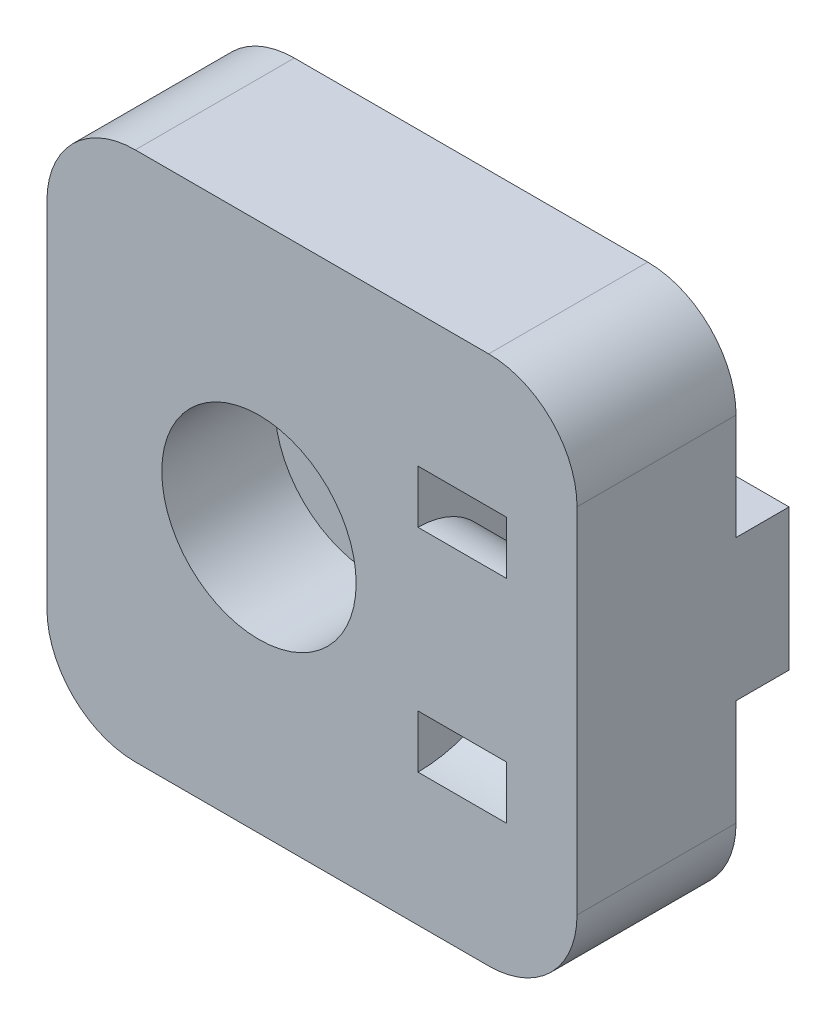
from build123d import *

# Parameters (mm, degrees)
SKICA1_W                                         = 30
SKICA1_H                                         = 30
P_IDAT_VYSUNUT_M1_DEPTH                          = 9
V_LCOV_ZAHLOUBEN_PRO_M6_ROUBY_S_VNIT_D           = 6.6
V_LCOV_ZAHLOUBEN_PRO_M6_ROUBY_S_VNIT_CBORE_D     = 11
V_LCOV_ZAHLOUBEN_PRO_M6_ROUBY_S_VNIT_CBORE_DEPTH = 6.4
TIE_SKETCH_R                                     = 7.5
TIE_SKETCH_R_2                                   = 4.5
ODEBRAT_VYSUNUT_M1_DEPTH                         = 5
P_IDAT_VYSUNUT_M2_DEPTH                          = 3
ZKOSEN_1_SIZE                                    = 3
ZAOBLIT1_R                                       = 5


with BuildPart() as part:
    # Skica1 → Přidat vysunutím1 (new body)
    with BuildSketch(Plane.XY):
        Rectangle(SKICA1_W, SKICA1_H)
    extrude(amount=P_IDAT_VYSUNUT_M1_DEPTH)

    # Válcové zahloubení pro M6 šrouby s vnitřním šestihranem1 (through all)
    with Locations(Plane.XY.offset(9)):
        with Locations((-3, 0), (-24.772543922, -8.516747489)):
            CounterBoreHole(V_LCOV_ZAHLOUBEN_PRO_M6_ROUBY_S_VNIT_D / 2, V_LCOV_ZAHLOUBEN_PRO_M6_ROUBY_S_VNIT_CBORE_D / 2, V_LCOV_ZAHLOUBEN_PRO_M6_ROUBY_S_VNIT_CBORE_DEPTH)

    # Tie sketch → Odebrat vysunutím1 (cut)
    with BuildSketch(Plane(origin=(11, 0, 0), x_dir=(0, 0, -1), z_dir=(1, 0, 0))):
        with Locations((-9, 0)):
            Circle(TIE_SKETCH_R)
        with Locations((-9, 0)):
            Circle(TIE_SKETCH_R_2, mode=Mode.SUBTRACT)
    extrude(amount=-ODEBRAT_VYSUNUT_M1_DEPTH, mode=Mode.SUBTRACT)

    # Skica6 → Přidat vysunutím2 (add)
    with BuildSketch(Plane(origin=(0, 0, 0), x_dir=(-1, 0, 0), z_dir=(0, 0, -1))):
        with BuildLine():
            ThreePointArc((-5.61684397, -4), (-6.5, 0), (-5.61684397, 4))
            Line((-5.61684397, 4), (-15, 4))
            Line((-15, 4), (-15, -4))
            Line((-15, -4), (-5.61684397, -4))
        make_face()
        with BuildLine():
            Line((15, 4), (11.61684397, 4))
            ThreePointArc((11.61684397, 4), (12.2765839, 2.048167753), (12.5, 0))
            ThreePointArc((12.5, 0), (12.2765839, -2.048167753), (11.61684397, -4))
            Line((11.61684397, -4), (15, -4))
            Line((15, -4), (15, 4))
        make_face()
    extrude(amount=P_IDAT_VYSUNUT_M2_DEPTH)

    # Zkosení1
    zkosen_1_edges = [part.edges().sort_by_distance(p)[0] for p in [
        (6.5, 0, -3),
    ]]
    chamfer(zkosen_1_edges, length=ZKOSEN_1_SIZE - 0.0001)  # a hair under: the kernel refuses the full size

    # Zaoblit1
    zaoblit1_edges = [part.edges().sort_by_distance(p)[0] for p in [
        (15, -15, 4.5),
        (-15, -15, 4.5),
        (-15, 15, 4.5),
        (15, 15, 4.5),
    ]]
    fillet(zaoblit1_edges, radius=ZAOBLIT1_R)


solid = part.part
